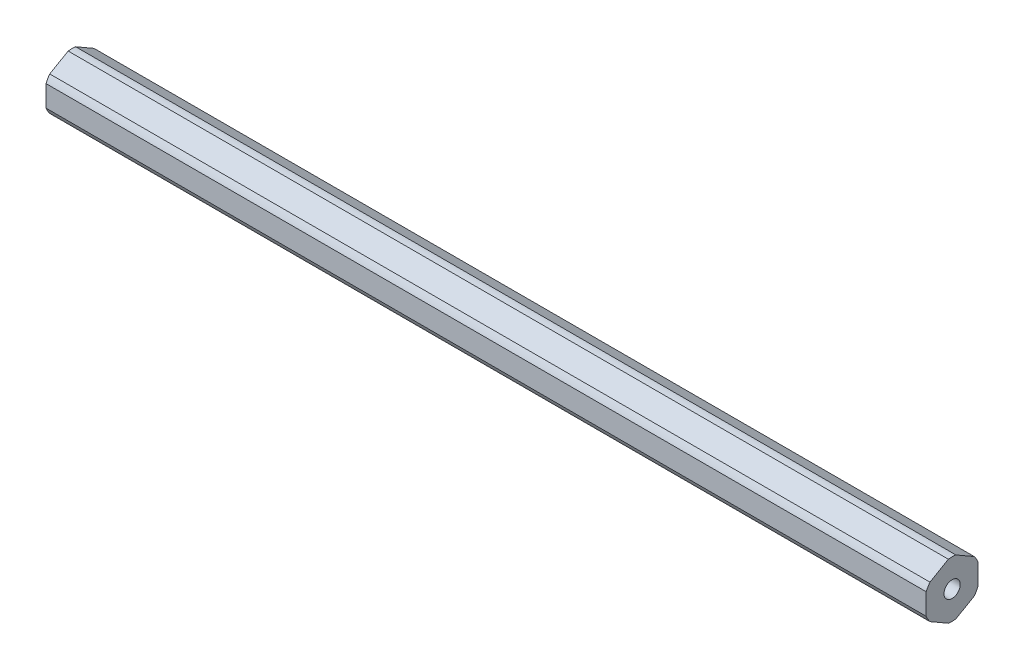
from build123d import *

# Parameters (mm, degrees)
SKETCH1_R           = 1.9939
BOSS_EXTRUDE1_DEPTH = 215.9


with BuildPart() as part:
    # Sketch1 → Boss-Extrude1 (new body)
    with BuildSketch(Plane(origin=(914.4, 0, 0), x_dir=(0, 0, -1), z_dir=(1, 0, 0))):
        with BuildLine():
            Line((-5.43426841, -4.194872089), (-0.91573159, -6.803650539))
            ThreePointArc((-0.91573159, -6.803650539), (0, -6.865), (0.91573159, -6.803650539))
            Line((0.91573159, -6.803650539), (5.43426841, -4.194872089))
            ThreePointArc((5.43426841, -4.194872089), (5.945264397, -3.4325), (6.35, -2.60877845))
            Line((6.35, -2.60877845), (6.35, 2.60877845))
            ThreePointArc((6.35, 2.60877845), (5.945264397, 3.4325), (5.43426841, 4.194872089))
            Line((5.43426841, 4.194872089), (0.91573159, 6.803650539))
            ThreePointArc((0.91573159, 6.803650539), (0, 6.865), (-0.91573159, 6.803650539))
            Line((-0.91573159, 6.803650539), (-5.43426841, 4.194872089))
            ThreePointArc((-5.43426841, 4.194872089), (-5.945264397, 3.4325), (-6.35, 2.60877845))
            Line((-6.35, 2.60877845), (-6.35, -2.60877845))
            ThreePointArc((-6.35, -2.60877845), (-5.945264397, -3.4325), (-5.43426841, -4.194872089))
        make_face()
        Circle(SKETCH1_R, mode=Mode.SUBTRACT)
    extrude(amount=-BOSS_EXTRUDE1_DEPTH)


solid = part.part
